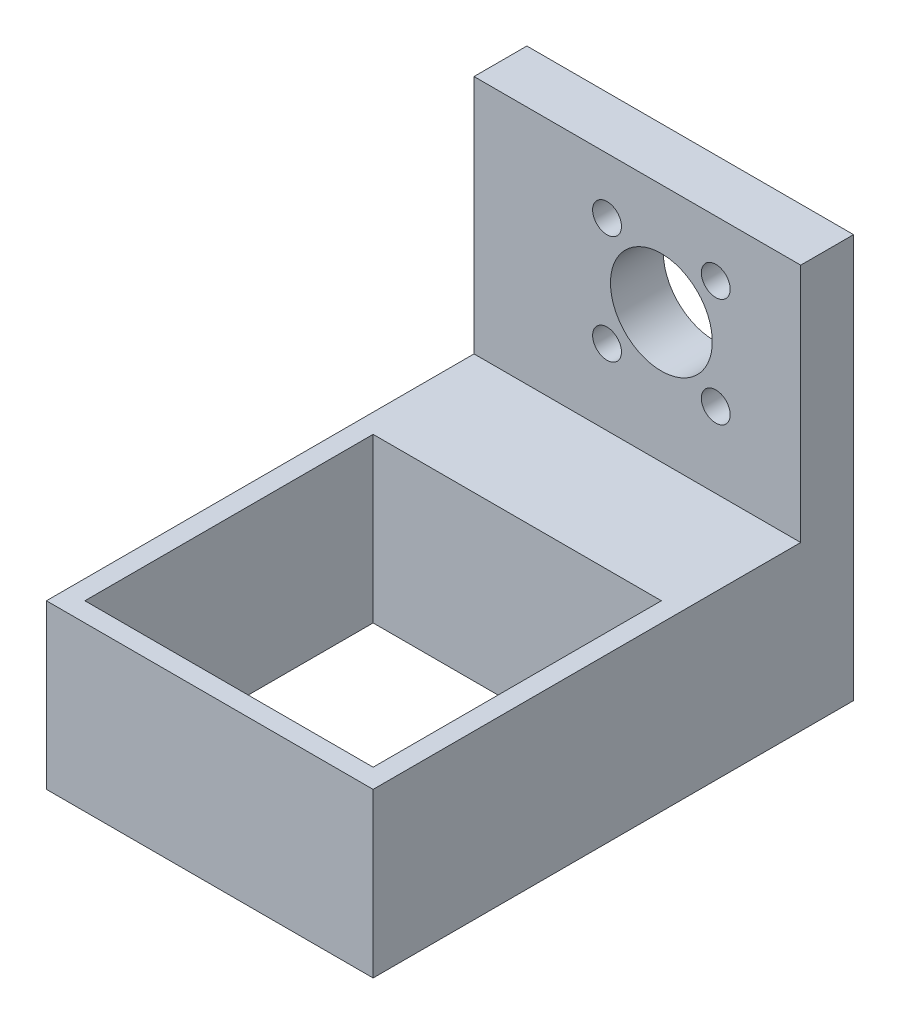
from build123d import *

# Parameters (mm, degrees)
SZKIC1_W                    = 34
SZKIC1_H                    = 50
DODANIE_WYCI_GNI_CIE1_DEPTH = 17
SZKIC2_W                    = 30
SZKIC2_H                    = 30
WYTNIJ_WYCI_GNI_CIE1_DEPTH  = 20
SZKIC3_W                    = 34
SZKIC3_H                    = 5.5
DODANIE_WYCI_GNI_CIE2_DEPTH = 25
SZKIC4_R                    = 1.5
SZKIC4_R_2                  = 5.3
WYTNIJ_WYCI_GNI_CIE2_DEPTH  = 25


with BuildPart() as part:
    # Szkic1 → Dodanie-wyciągnięcie1 (new body)
    with BuildSketch(Plane(origin=(0, 0, 0), x_dir=(1, 0, 0), z_dir=(0, 1, 0))):
        Rectangle(SZKIC1_W, SZKIC1_H)
    extrude(amount=DODANIE_WYCI_GNI_CIE1_DEPTH)

    # Szkic2 → Wytnij-wyciągnięcie1 (cut)
    with BuildSketch(Plane(origin=(0, 17, 0), x_dir=(1, 0, 0), z_dir=(0, 1, 0))):
        with Locations((0, -8)):
            Rectangle(SZKIC2_W, SZKIC2_H)
    extrude(amount=-WYTNIJ_WYCI_GNI_CIE1_DEPTH, mode=Mode.SUBTRACT)

    # Szkic3 → Dodanie-wyciągnięcie2 (add)
    with BuildSketch(Plane(origin=(0, 17, 0), x_dir=(1, 0, 0), z_dir=(0, 1, 0))):
        with Locations((0, 22.25)):
            Rectangle(SZKIC3_W, SZKIC3_H)
    extrude(amount=DODANIE_WYCI_GNI_CIE2_DEPTH)

    # Szkic4 → Wytnij-wyciągnięcie2 (cut)
    with BuildSketch(Plane(origin=(0, 0, -25), x_dir=(-1, 0, 0), z_dir=(0, 0, -1))):
        with Locations((3.156854249, 36.156854249)):
            Circle(SZKIC4_R)
        with Locations((-8.156854249, 36.156854249)):
            Circle(SZKIC4_R)
        with Locations((3.156854249, 24.843145751)):
            Circle(SZKIC4_R)
        with Locations((-8.156854249, 24.843145751)):
            Circle(SZKIC4_R)
        with Locations((-2.5, 30.5)):
            Circle(SZKIC4_R_2)
    extrude(amount=-WYTNIJ_WYCI_GNI_CIE2_DEPTH, mode=Mode.SUBTRACT)


solid = part.part
